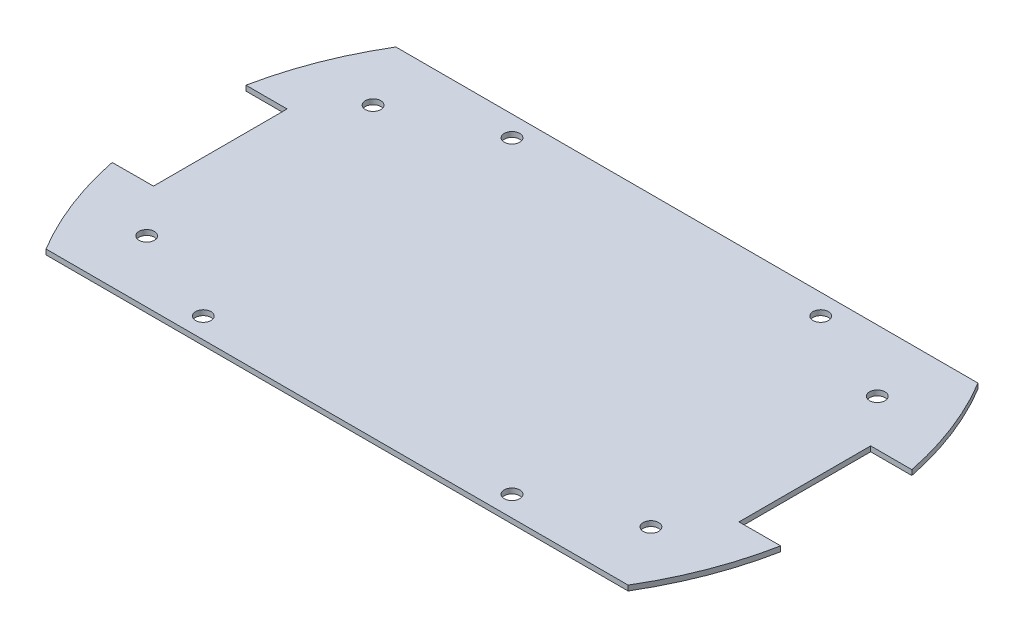
from build123d import *

# Parameters (mm, degrees)
EXTRUDE_2_DEPTH             = 1
F_3_0MM_1_D                 = 3
F_3_0MM_1_DEPTH             = 4
F_3_0MM_1_TIP               = 0.901290929
F_3_0MM_1_ON_FACE_2_D       = 3
F_3_0MM_1_ON_FACE_2_DEPTH   = 4
F_3_0MM_1_ON_FACE_2_TIP     = 0.901290929
PATTERN_LINEAR_1_COUNT      = 2
PATTERN_LINEAR_1_PITCH      = 98
PATTERN_LINEAR_1_COUNT_DIR2 = 2
PATTERN_LINEAR_1_PITCH_DIR2 = 44


with BuildPart() as part:
    # 草圖10 → 填料-伸長2 (new body)
    with BuildSketch(Plane(origin=(0, 0, 0), x_dir=(1, 0, 0), z_dir=(0, 1, 0))):
        with BuildLine():
            Line((56.568542495, 34), (-56.568542495, 34))
            ThreePointArc((-56.568542495, 34), (-61.540159626, 23.849711805), (-64.707032075, 13))
            Line((-64.707032075, 13), (-56.707032075, 13))
            Line((-56.707032075, 13), (-56.707032075, -12.973279994))
            Line((-56.707032075, -12.973279994), (-64.707032075, -13))
            ThreePointArc((-64.707032075, -13), (-61.540159626, -23.849711805), (-56.568542495, -34))
            Line((-56.568542495, -34), (56.568542495, -34))
            ThreePointArc((56.568542495, -34), (61.619473981, -23.644035746), (64.792427449, -12.567471713))
            Line((64.792427449, -12.567471713), (56.707032075, -12.594476939))
            Line((56.707032075, -12.594476939), (56.707032075, 13))
            Line((56.707032075, 13), (64.707032075, 13))
            ThreePointArc((64.707032075, 13), (61.540159626, 23.849711805), (56.568542495, 34))
        make_face()
    extrude(amount=EXTRUDE_2_DEPTH)

    # Ø3.0mm 定位孔1
    with Locations(Plane(origin=(30, 1, 30), x_dir=(0, 0, 1), z_dir=(0, 1, 0))):
        with Locations((0, 0), (-60, -60), (0, -60), (-60, 0)):
            Hole(F_3_0MM_1_D / 2, depth=F_3_0MM_1_DEPTH)
            with Locations((0, 0, -(F_3_0MM_1_DEPTH + F_3_0MM_1_TIP / 2))):  # 118° drill point
                Cone(0, F_3_0MM_1_D / 2, F_3_0MM_1_TIP, mode=Mode.SUBTRACT)

    # Ø3.0mm 定位孔1 on face 2
    with Locations(Plane(origin=(-30, 0, -30), x_dir=(0, 0, -1), z_dir=(0, -1, 0))):
        with Locations((0, 0)):
            Hole(F_3_0MM_1_ON_FACE_2_D / 2, depth=F_3_0MM_1_ON_FACE_2_DEPTH)
            with Locations((0, 0, -(F_3_0MM_1_ON_FACE_2_DEPTH + F_3_0MM_1_ON_FACE_2_TIP / 2))):  # 118° drill point
                Cone(0, F_3_0MM_1_ON_FACE_2_D / 2, F_3_0MM_1_ON_FACE_2_TIP, mode=Mode.SUBTRACT)

    # 草圖14 → Ø3.0mm 定位孔2 (revolve, cut)
    with BuildSketch(Plane(origin=(-49, 1, -22), x_dir=(0, 0, 1), z_dir=(1, 0, 0))):
        Polygon((0, 0), (0, 4.901290929), (1.5, 4), (1.5, 0), align=None)
    f_3_0mm_2 = revolve(axis=Axis((-49, 7.35, -22), (0, -1, 0)), mode=Mode.SUBTRACT)

    # 直線複製排列1: 3.0mm _2 2 × 2
    with Locations(*[(i * PATTERN_LINEAR_1_PITCH, 0, j * PATTERN_LINEAR_1_PITCH_DIR2) for i in range(PATTERN_LINEAR_1_COUNT) for j in range(PATTERN_LINEAR_1_COUNT_DIR2) if (i, j) != (0, 0)]):
        add(f_3_0mm_2, mode=Mode.SUBTRACT)


solid = part.part
